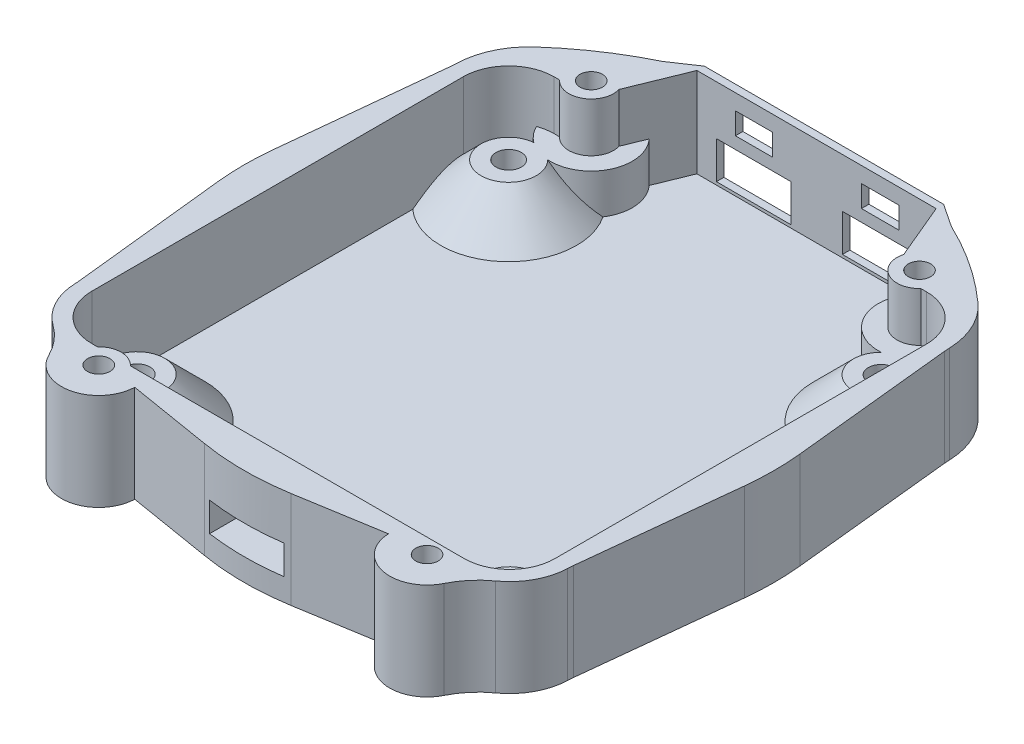
from build123d import *
from build123d.topology import SkipClean

# Parameters (mm, degrees)
SKETCH1_R            = 1.5
BOSS_EXTRUDE1_DEPTH  = 12
SKETCH2_W            = 32.064783114
SKETCH2_H            = 12
SKETCH2_W_2          = 5
SKETCH2_H_2          = 2.9
SKETCH2_W_3          = 10
SKETCH2_H_3          = 5
BOSS_EXTRUDE2_DEPTH  = 1
FILLET1_R            = 10
BOSS_EXTRUDE3_DEPTH  = 12
BOSS_EXTRUDE4_START  = -12
BOSS_EXTRUDE4_DEPTH  = 12
SKETCH5_R            = 1.5
BOSS_EXTRUDE5_DEPTH  = 1
SKETCH6_R            = 3.6999966
SKETCH6_R_2          = 1.6999966
BOSS_EXTRUDE6_DEPTH  = 6.4
SKETCH8_R            = 3.6
CUT_EXTRUDE2_DEPTH   = 5
BOSS_EXTRUDE7_DEPTH  = 5.4
BOSS_EXTRUDE8_START  = -1.4
BOSS_EXTRUDE8_DEPTH  = 1.4
CHAMFER1_SIZE        = 5.4
BOSS_EXTRUDE9_START  = -13
BOSS_EXTRUDE9_DEPTH  = 13
SKETCH7_W            = 9
SKETCH7_H            = 2.9
SKETCH7_W_2          = 10
SKETCH7_H_2          = 3.9
CUT_EXTRUDE3_DEPTH   = 5
FILLET2_R            = 10
BOSS_EXTRUDE13_START = -6.6
BOSS_EXTRUDE13_DEPTH = 6.6


with BuildPart() as part:
    # Sketch1 → Boss-Extrude1 (new body)
    with BuildSketch(Plane.XZ.offset(34.71)):
        with BuildLine():
            ThreePointArc((15.958056665, -41.540226618), (25.188592341, -36.684939905), (33.0355, -29.814522296))
            Line((33.0355, -29.814522296), (33.0355, 24.892))
            ThreePointArc((33.0355, 24.892), (30.668922792, 30.605422792), (24.9555, 32.972))
            Line((24.9555, 32.972), (23.499738644, 32.972))
            ThreePointArc((23.499738644, 32.972), (22, 31.5), (20.500261356, 32.972))
            Line((20.500261356, 32.972), (-20.500261356, 32.972))
            ThreePointArc((-20.500261356, 32.972), (-22, 31.5), (-23.499738644, 32.972))
            Line((-23.499738644, 32.972), (-24.9555, 32.972))
            ThreePointArc((-24.9555, 32.972), (-30.668922792, 30.605422792), (-33.0355, 24.892))
            Line((-33.0355, 24.892), (-33.0355, -29.814522296))
            ThreePointArc((-33.0355, -29.814522296), (-25.254243765, -36.639775816), (-16.106726449, -41.482808043))
            Line((-16.106726449, -41.482808043), (-20.299239769, -30.972))
            Line((-20.299239769, -30.972), (-24.9555, -30.972))
            ThreePointArc((-24.9555, -30.972), (-29.25470923, -29.19120923), (-31.0355, -24.892))
            Line((-31.0355, -24.892), (-31.0355, 24.892))
            ThreePointArc((-31.0355, 24.892), (-29.25470923, 29.19120923), (-24.9555, 30.972))
            Line((-24.9555, 30.972), (24.9555, 30.972))
            ThreePointArc((24.9555, 30.972), (29.25470923, 29.19120923), (31.0355, 24.892))
            Line((31.0355, 24.892), (31.0355, -24.892))
            ThreePointArc((31.0355, -24.892), (29.25470923, -29.19120923), (24.9555, -30.972))
            Line((24.9555, -30.972), (20.29221702, -30.972))
            Line((20.29221702, -30.972), (15.958056665, -41.540226618))
        make_face()
        with Locations((22, -33)):
            Circle(SKETCH1_R, mode=Mode.SUBTRACT)
        with Locations((-22, -33)):
            Circle(SKETCH1_R, mode=Mode.SUBTRACT)
    extrude(amount=BOSS_EXTRUDE1_DEPTH)

    # Fillet1
    fillet1_edges = [part.edges().sort_by_distance(p)[0] for p in [
        (33.0355, -40.71, -29.814522296),
        (-33.0355, -40.71, -29.814522296),
    ]]
    fillet(fillet1_edges, radius=FILLET1_R)



with BuildPart() as body_2:
    # Sketch2 → Boss-Extrude2 (new body)
    with BuildSketch(Plane(origin=(0, 0, -41.275), x_dir=(-1, 0, 0), z_dir=(0, 0, -1))):
        with Locations((0.074334892, -40.71)):
            Rectangle(SKETCH2_W, SKETCH2_H)
        with Locations((-8.4455026, -38.26)):
            Rectangle(SKETCH2_W_2, SKETCH2_H_2, mode=Mode.SUBTRACT)
        with Locations((8.4454974, -38.26)):
            Rectangle(SKETCH2_W_2, SKETCH2_H_2, mode=Mode.SUBTRACT)
        with Locations((-8.395622, -43.81)):
            Rectangle(SKETCH2_W_3, SKETCH2_H_3, mode=Mode.SUBTRACT)
        with Locations((8.495378, -43.81)):
            Rectangle(SKETCH2_W_3, SKETCH2_H_3, mode=Mode.SUBTRACT)
    extrude(amount=BOSS_EXTRUDE2_DEPTH)


with BuildPart() as part_1:
    add(part.part)

    add(body_2.part)  # Boss-Extrude3 merges body 2
    # Sketch3 → Boss-Extrude3 (add)
    with BuildSketch(Plane(origin=(0, -34.71, 0), x_dir=(1, 0, 0), z_dir=(0, 1, 0))):
        with BuildLine():
            ThreePointArc((-19.465302171, 40.016896574), (-17.801110335, 40.784439077), (-16.106726449, 41.482808043))
            Line((-16.106726449, 41.482808043), (-16.106726449, 42.275))
            Line((-16.106726449, 42.275), (-19.465302171, 40.016896574))
        make_face()
        with BuildLine():
            Line((15.958056665, 42.275), (15.958056665, 41.540226618))
            ThreePointArc((15.958056665, 41.540226618), (17.522859162, 40.904760197), (19.062421092, 40.210373066))
            Line((19.062421092, 40.210373066), (15.958056665, 42.275))
        make_face()
        Polygon((15.958056665, 41.540226618), (15.958056665, 41.275), (20.29221702, 30.972), align=None)
        Polygon((-20.299239769, 30.972), (-16.106726449, 41.275), (-16.106726449, 41.482808043), align=None)
    extrude(amount=-BOSS_EXTRUDE3_DEPTH)

    # Boss-Extrude4: read off the stored shape, not the designer's step
    # Boss-Extrude4 outline → Boss-Extrude4 (add)
    with BuildSketch(Plane.XZ.offset(46.71).offset(BOSS_EXTRUDE4_START)):
        with BuildLine():
            ThreePointArc((20.500261356, 32.972), (22, 34.5), (23.499738644, 32.972))
            Line((23.499738644, 32.972), (24.9555, 32.972))
            ThreePointArc((24.9555, 32.972), (25.981892089, 32.906544234), (26.991654654, 32.711237445))
            ThreePointArc((26.991654654, 32.711237445), (22.130446783, 37.998298074), (17.000078401, 32.972))
            Line((17.000078401, 32.972), (20.500261356, 32.972))
        make_face()
        with BuildLine():
            Line((-20.500261356, 32.972), (-17.000078401, 32.972))
            ThreePointArc((-17.000078401, 32.972), (-22.130446783, 37.998298074), (-26.991654654, 32.711237445))
            ThreePointArc((-26.991654654, 32.711237445), (-25.981892089, 32.906544234), (-24.9555, 32.972))
            Line((-24.9555, 32.972), (-23.499738644, 32.972))
            ThreePointArc((-23.499738644, 32.972), (-22, 34.5), (-20.500261356, 32.972))
        make_face()
    extrude(amount=BOSS_EXTRUDE4_DEPTH)

    # Sketch5 → Boss-Extrude5 (add)
    with SkipClean():  # the faces are left unmerged after this step: merging them gives an invalid solid
        with BuildSketch(Plane.XZ.offset(46.71)):
            with BuildLine():
                Line((-33.0355, 24.892), (-33.0355, -25.682985413))
                ThreePointArc((-33.0355, -25.682985413), (-32.16702685, -29.759162224), (-29.712456522, -33.127329012))
                ThreePointArc((-29.712456522, -33.127329012), (-24.829005675, -36.929263155), (-19.465302171, -40.016896574))
                Line((-19.465302171, -40.016896574), (-16.106726449, -42.275))
                Line((-16.106726449, -42.275), (15.958056665, -42.275))
                Line((15.958056665, -42.275), (19.062421092, -40.210373066))
                ThreePointArc((19.062421092, -40.210373066), (24.643245522, -37.053480945), (29.712456522, -33.127329012))
                ThreePointArc((29.712456522, -33.127329012), (32.16702685, -29.759162224), (33.0355, -25.682985413))
                Line((33.0355, -25.682985413), (33.0355, 24.892))
                ThreePointArc((33.0355, 24.892), (31.348407383, 29.833369769), (26.991654654, 32.711237445))
                ThreePointArc((26.991654654, 32.711237445), (22.130446783, 37.998298074), (17.000078401, 32.972))
                Line((17.000078401, 32.972), (-17.000078401, 32.972))
                ThreePointArc((-17.000078401, 32.972), (-22.130446783, 37.998298074), (-26.991654654, 32.711237445))
                ThreePointArc((-26.991654654, 32.711237445), (-31.348407383, 29.833369769), (-33.0355, 24.892))
            make_face()
            with Locations((-22, 33)):
                Circle(SKETCH5_R, mode=Mode.SUBTRACT)
            with Locations((22, 33)):
                Circle(SKETCH5_R, mode=Mode.SUBTRACT)
            with Locations((22, -33)):
                Circle(SKETCH5_R, mode=Mode.SUBTRACT)
            with Locations((-22, -33)):
                Circle(SKETCH5_R, mode=Mode.SUBTRACT)
        extrude(amount=BOSS_EXTRUDE5_DEPTH)

    # Sketch6 → Boss-Extrude6 (add)
    # profile 1 of 4: a face of its own
    with SkipClean():  # the faces are left unmerged after this step: merging them gives an invalid solid
        with BuildSketch(Plane.XZ.offset(47.71)):
            with Locations((-24.9555, -24.892)):
                Circle(SKETCH6_R)
            with Locations((-24.9555, -24.892)):
                Circle(SKETCH6_R_2, mode=Mode.SUBTRACT)
        # profile 2 of 4: a face of its own
        with BuildSketch(Plane.XZ.offset(47.71)):
            with Locations((24.9555, -24.892)):
                Circle(SKETCH6_R)
            with Locations((24.9555, -24.892)):
                Circle(SKETCH6_R_2, mode=Mode.SUBTRACT)
        # profile 3 of 4: a face of its own
        with BuildSketch(Plane.XZ.offset(47.71)):
            with Locations((24.9555, 24.892)):
                Circle(SKETCH6_R)
            with Locations((24.9555, 24.892)):
                Circle(SKETCH6_R_2, mode=Mode.SUBTRACT)
        # profile 4 of 4: a face of its own
        with BuildSketch(Plane.XZ.offset(47.71)):
            with Locations((-24.9555, 24.892)):
                Circle(SKETCH6_R)
            with Locations((-24.9555, 24.892)):
                Circle(SKETCH6_R_2, mode=Mode.SUBTRACT)
        extrude(amount=-BOSS_EXTRUDE6_DEPTH)

    # Sketch8 → Cut-Extrude2 (cut)
    with BuildSketch(Plane.XZ.offset(47.71)):
        with Locations((-22, 33)):
            Circle(SKETCH8_R)
        with Locations((22, 33)):
            Circle(SKETCH8_R)
        with Locations((22, -33)):
            Circle(SKETCH8_R)
        with Locations((-22, -33)):
            Circle(SKETCH8_R)
    extrude(amount=-CUT_EXTRUDE2_DEPTH, mode=Mode.SUBTRACT)

    # Sketch9 → Boss-Extrude7 (add)
    with BuildSketch(Plane(origin=(0, -46.71, 0), x_dir=(1, 0, 0), z_dir=(0, 1, 0))):
        with BuildLine():
            ThreePointArc((-18.80161604, 34.652374063), (-20.156393797, 29.907894541), (-24.97440696, 30.971970602))
            ThreePointArc((-24.97440696, 30.971970602), (-25.983240741, 30.884507736), (-26.963566455, 30.63082123))
            ThreePointArc((-26.963566455, 30.63082123), (-26.24330384, 29.500804018), (-25.271147889, 28.578508002))
            ThreePointArc((-25.271147889, 28.578508002), (-23.688349877, 28.368248755), (-22.341530871, 27.510614182))
            ThreePointArc((-22.341530871, 27.510614182), (-17.033276388, 30.637447025), (-17.9567658, 36.728573078))
            Line((-17.9567658, 36.728573078), (-18.80161604, 34.652374063))
        make_face()
        with BuildLine():
            ThreePointArc((-25.271147889, -28.578508002), (-26.24330384, -29.500804018), (-26.963566455, -30.63082123))
            ThreePointArc((-26.963566455, -30.63082123), (-25.983240741, -30.884507736), (-24.97440696, -30.971970602))
            ThreePointArc((-24.97440696, -30.971970602), (-21.99998221, -29.4), (-19.025572996, -30.972))
            Line((-19.025572996, -30.972), (-16.887543056, -30.972))
            ThreePointArc((-16.887543056, -30.972), (-19.052843431, -28.35626571), (-22.341530871, -27.510614182))
            ThreePointArc((-22.341530871, -27.510614182), (-23.688349877, -28.368248755), (-25.271147889, -28.578508002))
        make_face()
        with BuildLine():
            Line((18.77019745, 34.590086629), (17.897890874, 36.663700413))
            ThreePointArc((17.897890874, 36.663700413), (17.052249592, 30.597966298), (22.341530871, 27.510614182))
            ThreePointArc((22.341530871, 27.510614182), (23.688349877, 28.368248755), (25.271147889, 28.578508002))
            ThreePointArc((25.271147889, 28.578508002), (26.24330384, 29.500804018), (26.963566455, 30.63082123))
            ThreePointArc((26.963566455, 30.63082123), (25.983240741, 30.884507736), (24.97440696, 30.971970602))
            ThreePointArc((24.97440696, 30.971970602), (20.186440621, 29.890176472), (18.77019745, 34.590086629))
        make_face()
        with BuildLine():
            ThreePointArc((22.341530871, -27.510614182), (19.052843431, -28.35626571), (16.887543056, -30.972))
            Line((16.887543056, -30.972), (19.025572996, -30.972))
            ThreePointArc((19.025572996, -30.972), (21.99998221, -29.4), (24.97440696, -30.971970602))
            ThreePointArc((24.97440696, -30.971970602), (25.983240741, -30.884507736), (26.963566455, -30.63082123))
            ThreePointArc((26.963566455, -30.63082123), (26.24330384, -29.500804018), (25.271147889, -28.578508002))
            ThreePointArc((25.271147889, -28.578508002), (23.688349877, -28.368248755), (22.341530871, -27.510614182))
        make_face()
    extrude(amount=BOSS_EXTRUDE7_DEPTH)


with BuildPart() as boss_extrude8_tool:
    # Boss-Extrude8: read off the stored shape, not the designer's step
    # Boss-Extrude8 outline → Boss-Extrude8 (new body)
    with BuildSketch(Plane.XZ.offset(42.71).offset(BOSS_EXTRUDE8_START)):
        with BuildLine():
            ThreePointArc((-18.80161604, -34.652374063), (-20.156393797, -29.907894541), (-24.97440696, -30.971970602))
            Line((-24.97440696, -30.971970602), (-24.9555, -30.972))
            Line((-24.9555, -30.972), (-20.299239769, -30.972))
            Line((-20.299239769, -30.972), (-18.80161604, -34.652374063))
        make_face()
        with BuildLine():
            ThreePointArc((24.97440696, -30.971970602), (20.186440621, -29.890176472), (18.77019745, -34.590086629))
            Line((18.77019745, -34.590086629), (20.29221702, -30.972))
            Line((20.29221702, -30.972), (24.9555, -30.972))
            Line((24.9555, -30.972), (24.97440696, -30.971970602))
        make_face()
        with BuildLine():
            ThreePointArc((19.025572996, 30.972), (21.99998221, 29.4), (24.97440696, 30.971970602))
            Line((24.97440696, 30.971970602), (19.025572996, 30.972))
        make_face()
        with BuildLine():
            ThreePointArc((-24.97440696, 30.971970602), (-21.99998221, 29.4), (-19.025572996, 30.972))
            Line((-19.025572996, 30.972), (-24.9555, 30.972))
            ThreePointArc((-24.9555, 30.972), (-24.964953491, 30.971992651), (-24.97440696, 30.971970602))
        make_face()
    extrude(amount=BOSS_EXTRUDE8_DEPTH)


with BuildPart() as part_2:
    add(part_1.part)


with BuildPart() as part_3:
    # Boss-Extrude8: joined with boss_extrude8_tool
    add(part_2.part.fuse(boss_extrude8_tool.part, tol=0.00001))

    # Chamfer1
    chamfer1_edges = [part_3.edges().sort_by_distance(p)[0] for p in [
        (-26.222650123, -46.71, 21.415751245),
        (26.222650123, -46.71, 21.415751245),
        (26.222650123, -46.71, -21.415751245),
        (-26.222650123, -46.71, -21.415751245),
    ]]
    chamfer(chamfer1_edges, length=CHAMFER1_SIZE - 0.0001)  # a hair under: the kernel refuses the full size

    # Sketch12 → Boss-Extrude9 (add)
    with BuildSketch(Plane.XZ.offset(47.71).offset(BOSS_EXTRUDE9_START)):
        with BuildLine():
            Line((-35.312036342, -3.648299523), (-33.0355, -25.682985413))
            Line((-33.0355, -25.682985413), (-33.0355, -12.9963741))
            Line((-33.0355, -12.9963741), (-33.0355, 12.9963741))
            Line((-33.0355, 12.9963741), (-33.0355, 24.892))
            Line((-33.0355, 24.892), (-35.29785427, 3.783052196))
            ThreePointArc((-35.29785427, 3.783052196), (-35.499935354, 0.067748457), (-35.312036342, -3.648299523))
        make_face()
        with BuildLine():
            Line((-17.000078401, 32.972), (-13.156641517, 32.972))
            Line((-13.156641517, 32.972), (0, 32.972))
            Line((0, 32.972), (0, 35.5))
            ThreePointArc((0, 35.5), (-2.905299922, 35.380916217), (-5.791108346, 35.024463795))
            Line((-5.791108346, 35.024463795), (-17.002913048, 33.170651666))
            ThreePointArc((-17.002913048, 33.170651666), (-17.000508964, 33.071339914), (-17.000078401, 32.972))
        make_face()
        with BuildLine():
            Line((0, 35.5), (0, 32.972))
            Line((0, 32.972), (13.156641517, 32.972))
            Line((13.156641517, 32.972), (17.000078401, 32.972))
            ThreePointArc((17.000078401, 32.972), (17.000508964, 33.071339914), (17.002913048, 33.170651666))
            Line((17.002913048, 33.170651666), (5.791108346, 35.024463795))
            ThreePointArc((5.791108346, 35.024463795), (2.905299922, 35.380916217), (0, 35.5))
        make_face()
        with BuildLine():
            Line((33.0355, 12.9963741), (33.0355, -12.9963741))
            Line((33.0355, -12.9963741), (33.0355, -25.682985413))
            Line((33.0355, -25.682985413), (35.312036342, -3.648299523))
            ThreePointArc((35.312036342, -3.648299523), (35.499935354, 0.067748457), (35.29785427, 3.783052196))
            Line((35.29785427, 3.783052196), (33.0355, 24.892))
            Line((33.0355, 24.892), (33.0355, 12.9963741))
        make_face()
    extrude(amount=BOSS_EXTRUDE9_DEPTH)

    # Sketch7 → Cut-Extrude3 (cut, symmetric)
    with BuildSketch(Plane.XY.offset(32.972)):
        with Locations((-6.6e-06, -42.76)):
            Rectangle(SKETCH7_W, SKETCH7_H)
        with Locations((-6.6e-06, -42.76)):
            Rectangle(SKETCH7_W_2, SKETCH7_H_2)
    extrude(amount=CUT_EXTRUDE3_DEPTH, both=True, mode=Mode.SUBTRACT)

    # Fillet2
    fillet2_edges = [part_3.edges().sort_by_distance(p)[0] for p in [
        (-33.0355, -40.71, 24.892),
        (-33.0355, -41.21, -25.682985413),
        (33.0355, -41.21, -25.682985413),
        (26.991654654, -40.71, 32.711237445),
        (33.0355, -41.21, 24.892),
        (-26.991654654, -40.71, 32.711237445),
    ]]
    fillet(fillet2_edges, radius=FILLET2_R)

    # Boss-Extrude13: read off the stored shape, not the designer's step
    # Boss-Extrude13 outline → Boss-Extrude13 (add)
    with BuildSketch(Plane(origin=(0, -34.71, 0), x_dir=(1, 0, 0), z_dir=(0, 1, 0)).offset(BOSS_EXTRUDE13_START)):
        with BuildLine():
            Line((-20.299239769, 30.972), (-24.210704865, 30.972))
            ThreePointArc((-24.210704865, 30.972), (-20.519589336, 30.390711924), (-19.125121997, 33.857366005))
            Line((-19.125121997, 33.857366005), (-20.299239769, 30.972))
        make_face()
        with BuildLine():
            Line((20.29221702, 30.972), (19.106233505, 33.791274589))
            ThreePointArc((19.106233505, 33.791274589), (20.549579165, 30.373923192), (24.210704865, 30.972))
            Line((24.210704865, 30.972), (20.29221702, 30.972))
        make_face()
        with BuildLine():
            Line((-24.210704865, -30.972), (-19.789295135, -30.972))
            ThreePointArc((-19.789295135, -30.972), (-22, -30), (-24.210704865, -30.972))
        make_face()
    extrude(amount=BOSS_EXTRUDE13_DEPTH)


solid = part_3.part
